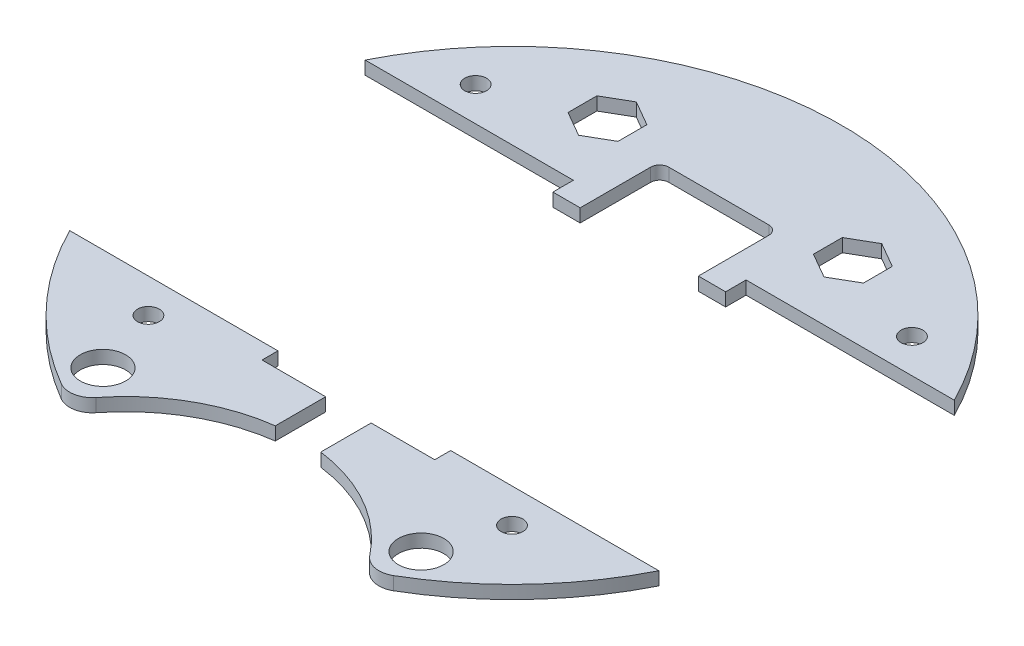
from build123d import *

# Parameters (mm, degrees)
BOSS_EXTRUDE1_DEPTH  = 2.9
SOLENOID_PLACEMENT_W = 38
SOLENOID_PLACEMENT_H = 64
CUT_EXTRUDE1_DEPTH   = 103.571487266
CUT_EXTRUDE4_DEPTH   = 103.571487266
CUT_EXTRUDE5_DEPTH   = 103.571487266
SKETCH6_R            = 2.4
CUT_EXTRUDE6_DEPTH   = 103.571487266
CUT_EXTRUDE3_DEPTH   = 103.571487266
SKETCH7_W            = 10
SKETCH7_H            = 50
CUT_EXTRUDE7_DEPTH   = 98.286484159
SKETCH9_R            = 5
CUT_EXTRUDE11_DEPTH  = 98.286484159


with BuildPart() as part:
    # Sketch1 → Boss-Extrude1 (new body)
    with BuildSketch(Plane(origin=(0, 0, 0), x_dir=(1, 0, 0), z_dir=(0, 1, 0))):
        with BuildLine():
            ThreePointArc((36.543377003, -62.616544118), (0, 72.5), (-36.543377003, -62.616544118))
            ThreePointArc((-36.543377003, -62.616544118), (-33.085954668, -63.20954405), (-30.089832649, -61.38507948))
            ThreePointArc((-30.089832649, -61.38507948), (0, -46.75), (30.089832649, -61.38507948))
            ThreePointArc((30.089832649, -61.38507948), (33.085954668, -63.20954405), (36.543377003, -62.616544118))
        make_face()
    extrude(amount=BOSS_EXTRUDE1_DEPTH)

    # solenoid placement → Cut-Extrude1 (cut, through all)
    with BuildSketch(Plane(origin=(0, 2.9, 0), x_dir=(1, 0, 0), z_dir=(0, 1, 0))):
        with Locations((0, -4)):
            Rectangle(SOLENOID_PLACEMENT_W, SOLENOID_PLACEMENT_H)
    extrude(amount=-CUT_EXTRUDE1_DEPTH, mode=Mode.SUBTRACT)

    # Sketch4 → Cut-Extrude4 (cut, through all)
    with BuildSketch(Plane(origin=(0, 2.9, 0), x_dir=(1, 0, 0), z_dir=(0, 1, 0))):
        with BuildLine():
            Line((-13, 28), (13, 28))
            Line((13, 28), (13, 43.5))
            ThreePointArc((13, 43.5), (12.414213562, 44.914213562), (11, 45.5))
            Line((11, 45.5), (-11, 45.5))
            ThreePointArc((-11, 45.5), (-12.414213562, 44.914213562), (-13, 43.5))
            Line((-13, 43.5), (-13, 28))
        make_face()
    extrude(amount=-CUT_EXTRUDE4_DEPTH, mode=Mode.SUBTRACT)

    # Sketch5 → Cut-Extrude5 (cut, through all)
    with BuildSketch(Plane(origin=(0, 2.9, 0), x_dir=(1, 0, 0), z_dir=(0, 1, 0))):
        Polygon((-21.5, 51.175426481), (-27, 54.350852961), (-32.5, 51.175426481), (-32.5, 44.824573519), (-27, 41.649147039), (-21.5, 44.824573519), align=None)
        Polygon((21.5, 44.824573519), (21.5, 51.175426481), (27, 54.350852961), (32.5, 51.175426481), (32.5, 44.824573519), (27, 41.649147039), align=None)
    extrude(amount=-CUT_EXTRUDE5_DEPTH, mode=Mode.SUBTRACT)

    # Sketch6 → Cut-Extrude6 (cut, through all)
    with BuildSketch(Plane(origin=(0, 2.9, 0), x_dir=(1, 0, 0), z_dir=(0, 1, 0))):
        with Locations((40, -40)):
            Circle(SKETCH6_R)
        with Locations((-40, -40)):
            Circle(SKETCH6_R)
        with Locations((48, 40)):
            Circle(SKETCH6_R)
        with Locations((-48, 40)):
            Circle(SKETCH6_R)
    extrude(amount=-CUT_EXTRUDE6_DEPTH, mode=Mode.SUBTRACT)

    # Sketch3 → Cut-Extrude3 (cut, through all)
    with BuildSketch(Plane(origin=(0, 2.9, 0), x_dir=(1, 0, 0), z_dir=(0, 1, 0))):
        Polygon((-19, 28), (-19, 32.5), (-72.5, 32.5), (-72.5, -32.5), (72.5, -32.5), (72.5, 32.5), (19, 32.5), (19, 28), align=None)
    extrude(amount=-CUT_EXTRUDE3_DEPTH, mode=Mode.SUBTRACT)


with BuildPart() as cut_extrude3_piece_1:
    # of the separate pieces the step leaves, piece 1, a body of its own (cut_extrude3_pieces)
    add(part.part.solids().sort_by_distance((64.807406984, 0, -32.5))[0])


with BuildPart() as cut_extrude3_piece_2:
    # of the separate pieces the step leaves, piece 2, a body of its own (cut_extrude3_pieces)
    add(part.part.solids().sort_by_distance((-36.543377003, 0, 62.616544118))[0])

    # Sketch7 → Cut-Extrude7 (cut, through all)
    with BuildSketch(Plane(origin=(0, 2.9, 0), x_dir=(1, 0, 0), z_dir=(0, 1, 0))):
        with Locations((0, -25)):
            Rectangle(SKETCH7_W, SKETCH7_H)
    extrude(amount=-CUT_EXTRUDE7_DEPTH, mode=Mode.SUBTRACT)


with BuildPart() as cut_extrude7_piece_1:
    # of the separate pieces the step leaves, piece 1, a body of its own (cut_extrude7_pieces)
    add(cut_extrude3_piece_2.part.solids().sort_by_distance((-36.543377003, 0, 62.616544118))[0])


with BuildPart() as cut_extrude7_piece_2:
    # of the separate pieces the step leaves, piece 2, a body of its own (cut_extrude7_pieces)
    add(cut_extrude3_piece_2.part.solids().sort_by_distance((5, 0, 47.078205475))[0])


with BuildPart() as cut_extrude11_tool:
    # Sketch9 → Cut-Extrude11 (new, through all)
    with BuildSketch(Plane.XZ.offset(-2.9)):
        with Locations((35, 55)):
            Circle(SKETCH9_R)
        with Locations((-35, 55)):
            Circle(SKETCH9_R)
    extrude(amount=CUT_EXTRUDE11_DEPTH)


with BuildPart() as cut_extrude7_piece_1_1:
    add(cut_extrude7_piece_1.part)

    # Cut-Extrude11: cut by cut_extrude11_tool
    add(cut_extrude11_tool.part, mode=Mode.SUBTRACT)


with BuildPart() as cut_extrude7_piece_2_1:
    add(cut_extrude7_piece_2.part)

    # Cut-Extrude11: cut by cut_extrude11_tool
    add(cut_extrude11_tool.part, mode=Mode.SUBTRACT)


solid = Compound([cut_extrude3_piece_1.part, cut_extrude7_piece_1_1.part, cut_extrude7_piece_2_1.part])
